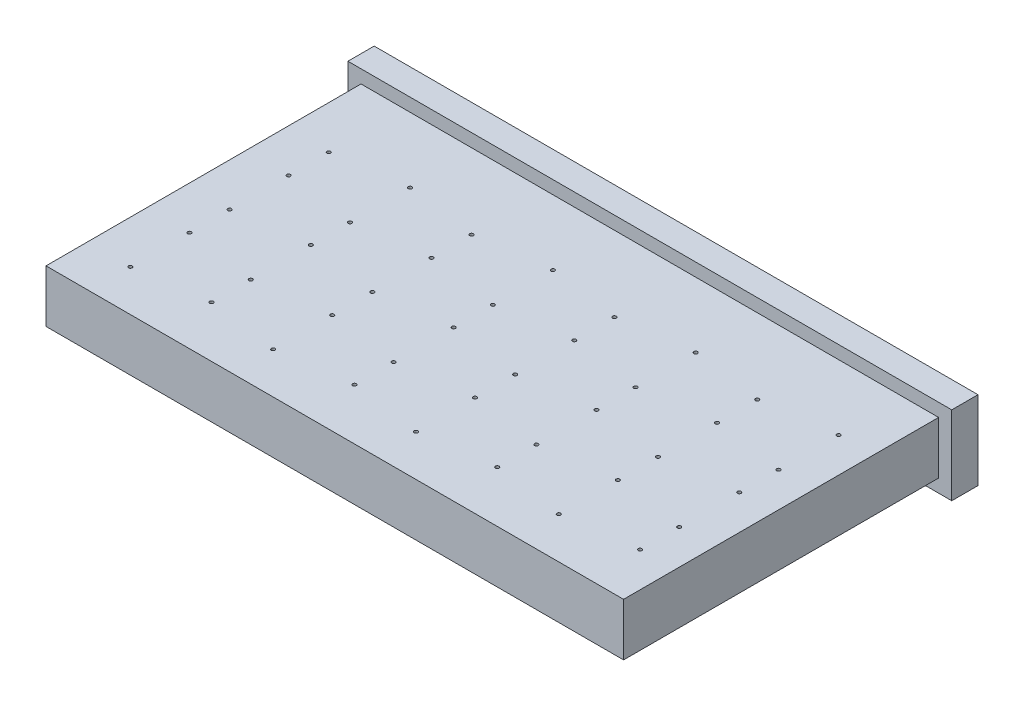
from build123d import *

# Parameters (mm, degrees)
SKETCH1_W           = 292.1
SKETCH1_H           = 38.1
BOSS_EXTRUDE1_DEPTH = 12.7
SKETCH2_W           = 279.4
SKETCH2_H           = 25.4
BOSS_EXTRUDE2_DEPTH = 152.4
SKETCH4_R           = 0.875
CUT_EXTRUDE1_DEPTH  = 223.703109543


with BuildPart() as part:
    # Sketch1 → Boss-Extrude1 (new body)
    with BuildSketch(Plane.XY):
        Rectangle(SKETCH1_W, SKETCH1_H)
    extrude(amount=BOSS_EXTRUDE1_DEPTH)

    # Sketch2 → Boss-Extrude2 (add)
    with BuildSketch(Plane.XY.offset(12.7)):
        Rectangle(SKETCH2_W, SKETCH2_H)
    extrude(amount=BOSS_EXTRUDE2_DEPTH)

    # Sketch4 → Cut-Extrude1 (cut, through all)
    with BuildSketch(Plane.XZ.offset(12.7)):
        with Locations((-118.894764252, 145.10793229)):
            Circle(SKETCH4_R)
        with Locations((88.369235748, 49.10609229)):
            Circle(SKETCH4_R)
        with Locations((122.869235748, 44.291146122)):
            Circle(SKETCH4_R)
        with Locations((122.869235748, 73.351013878)):
            Circle(SKETCH4_R)
        with Locations((88.369235748, 68.53606771)):
            Circle(SKETCH4_R)
        with Locations((88.369235748, 97.10701229)):
            Circle(SKETCH4_R)
        with Locations((122.869235748, 92.292066122)):
            Circle(SKETCH4_R)
        with Locations((122.869235748, 121.357013878)):
            Circle(SKETCH4_R)
        with Locations((122.869235748, 140.292986122)):
            Circle(SKETCH4_R)
        with Locations((88.369235748, 116.54206771)):
            Circle(SKETCH4_R)
        with Locations((88.369235748, 145.10793229)):
            Circle(SKETCH4_R)
        with Locations((53.781235748, 140.292986122)):
            Circle(SKETCH4_R)
        with Locations((53.781235748, 121.357013878)):
            Circle(SKETCH4_R)
        with Locations((53.781235748, 92.292066122)):
            Circle(SKETCH4_R)
        with Locations((53.781235748, 73.351013878)):
            Circle(SKETCH4_R)
        with Locations((53.781235748, 44.291146122)):
            Circle(SKETCH4_R)
        with Locations((19.281235748, 68.53606771)):
            Circle(SKETCH4_R)
        with Locations((19.281235748, 97.10701229)):
            Circle(SKETCH4_R)
        with Locations((19.281235748, 116.54206771)):
            Circle(SKETCH4_R)
        with Locations((19.281235748, 145.10793229)):
            Circle(SKETCH4_R)
        with Locations((-15.306764252, 140.292986122)):
            Circle(SKETCH4_R)
        with Locations((-15.306764252, 92.292066122)):
            Circle(SKETCH4_R)
        with Locations((-49.806764252, 97.10701229)):
            Circle(SKETCH4_R)
        with Locations((19.281235748, 49.10609229)):
            Circle(SKETCH4_R)
        with Locations((-15.306764252, 44.291146122)):
            Circle(SKETCH4_R)
        with Locations((-15.306764252, 73.351013878)):
            Circle(SKETCH4_R)
        with Locations((-49.806764252, 68.53606771)):
            Circle(SKETCH4_R)
        with Locations((-49.806764252, 49.10609229)):
            Circle(SKETCH4_R)
        with Locations((-49.806764252, 116.54206771)):
            Circle(SKETCH4_R)
        with Locations((-49.806764252, 145.10793229)):
            Circle(SKETCH4_R)
        with Locations((-84.394764252, 121.357013878)):
            Circle(SKETCH4_R)
        with Locations((-84.394764252, 92.292066122)):
            Circle(SKETCH4_R)
        with Locations((-84.394764252, 73.351013878)):
            Circle(SKETCH4_R)
        with Locations((-84.394764252, 44.291146122)):
            Circle(SKETCH4_R)
        with Locations((-118.894764252, 49.10609229)):
            Circle(SKETCH4_R)
        with Locations((-118.894764252, 68.53606771)):
            Circle(SKETCH4_R)
        with Locations((-118.894764252, 97.10701229)):
            Circle(SKETCH4_R)
        with Locations((-118.894764252, 116.54206771)):
            Circle(SKETCH4_R)
        with Locations((-84.394764252, 140.292986122)):
            Circle(SKETCH4_R)
        with Locations((-15.306764252, 121.357013878)):
            Circle(SKETCH4_R)
    extrude(amount=-CUT_EXTRUDE1_DEPTH, mode=Mode.SUBTRACT)


solid = part.part
